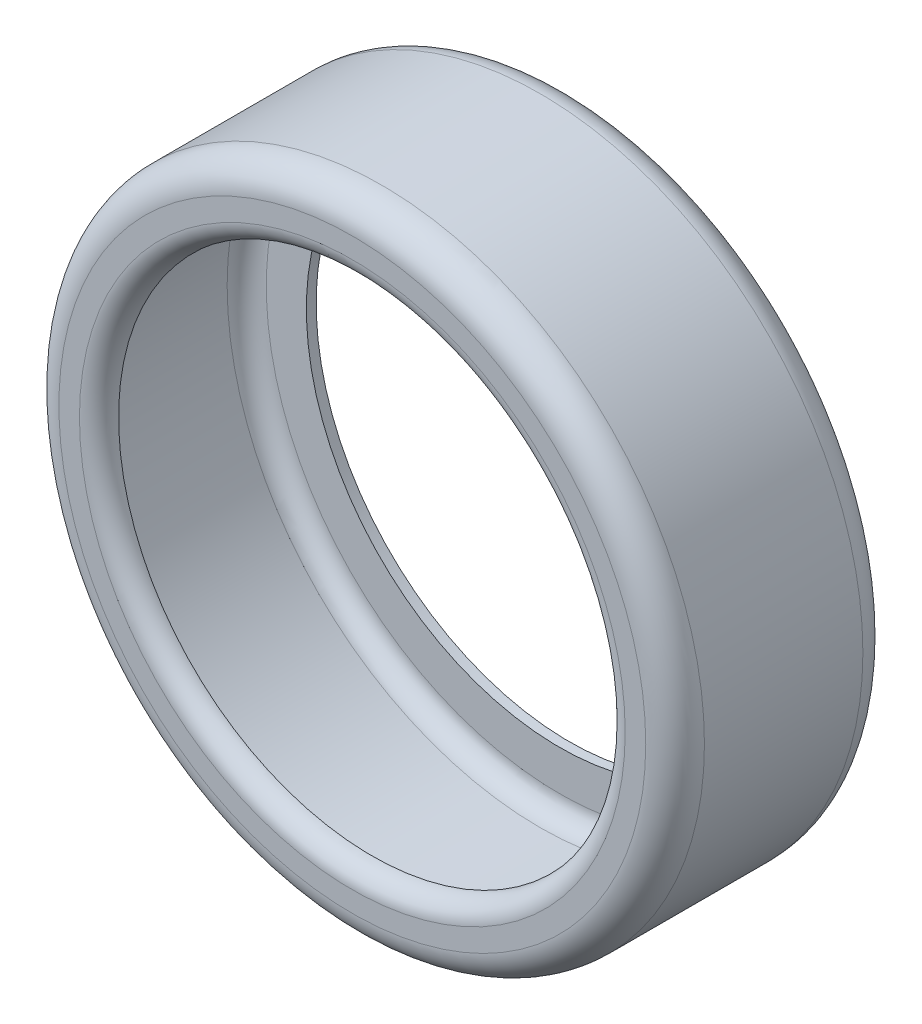
from build123d import *

# Parameters (mm, degrees)
SKETCH1_R           = 330
SKETCH1_R_2         = 259
BOSS_EXTRUDE1_DEPTH = 222
FILLET1_R           = 30
FILLET2_R           = 20


with BuildPart() as part:
    # Sketch1 → Boss-Extrude1 (new body)
    with BuildSketch(Plane.XY):
        Circle(SKETCH1_R)
        Circle(SKETCH1_R_2, mode=Mode.SUBTRACT)
    extrude(amount=BOSS_EXTRUDE1_DEPTH)

    # Fillet1
    fillet1_edges = [part.edges().sort_by_distance(p)[0] for p in [
        (-330, 0, 0),
        (-330, 0, 222),
    ]]
    fillet(fillet1_edges, radius=FILLET1_R)

    # Fillet2
    fillet2_edges = [part.edges().sort_by_distance(p)[0] for p in [
        (-259, 0, 222),
    ]]
    fillet(fillet2_edges, radius=FILLET2_R)

    # Shell2: read off the stored shape, not the designer's step
    # Shell2 outline → Shell2 (revolve, cut)
    with BuildSketch(Plane.XZ):
        with BuildLine():
            Line((269, 202), (259, 202))
            Line((259, 202), (259, 10))
            Line((259, 10), (300, 10))
            ThreePointArc((300, 10), (314.142135624, 15.857864376), (320, 30))
            Line((320, 30), (320, 192))
            ThreePointArc((320, 192), (314.142135624, 206.142135624), (300, 212))
            Line((300, 212), (279, 212))
            ThreePointArc((279, 212), (271.928932188, 209.071067812), (269, 202))
        make_face()
    revolve(axis=Axis((0, 0, 0), (0, 0, 1)), mode=Mode.SUBTRACT)


solid = part.part
